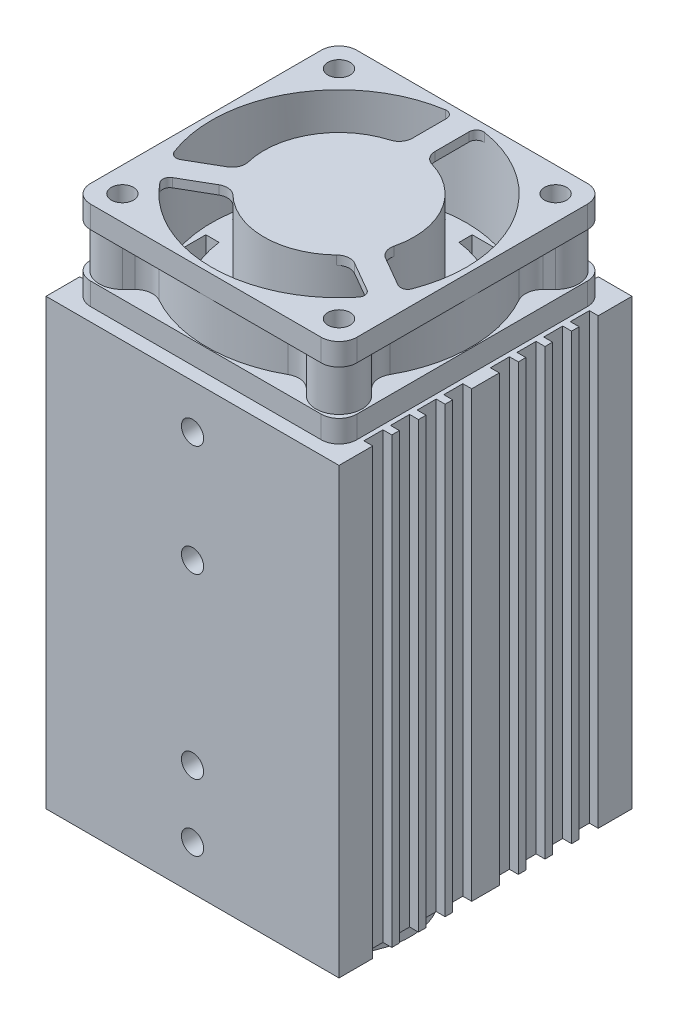
from build123d import *

# Parameters (mm, degrees)
SKIZZE1_W                       = 33
SKIZZE1_H                       = 33
AUFSATZ_LINEAR_AUSTRAGEN1_DEPTH = 50
SKIZZE2_R                       = 1.25
SCHNITT_LINEAR_AUSTRAGEN1_DEPTH = 5
SCHNITT_LINEAR_AUSTRAGEN3_DEPTH = 50
SKIZZE8_W                       = 1
SKIZZE8_H                       = 2.15
SCHNITT_LINEAR_AUSTRAGEN4_DEPTH = 63.982140326
KREISMUSTER10_COUNT             = 3
KREISMUSTER10_ANGLE             = 180
SKIZZE9_W                       = 30
SKIZZE9_H                       = 30
AUFSATZ_LINEAR_AUSTRAGEN4_DEPTH = 10
SCHNITT_LINEAR_AUSTRAGEN5_DEPTH = 10
SKIZZE12_R                      = 14.35
SKIZZE12_R_2                    = 8.45
SCHNITT_LINEAR_AUSTRAGEN6_DEPTH = 9
SKIZZE13_R                      = 1.25
SCHNITT_LINEAR_AUSTRAGEN7_DEPTH = 10
VERRUNDUNG3_R                   = 2
VERRUNDUNG4_R                   = 0.8
VERRUNDUNG5_START               = 59
VERRUNDUNG5_DEPTH               = 1
SCHNITT_LINEAR_AUSTRAGEN8_DEPTH = 5
KREISMUSTER11_COUNT             = 4


with BuildPart() as part:
    # Skizze1 → Aufsatz-Linear austragen1 (new body)
    with BuildSketch(Plane(origin=(0, 0, 0), x_dir=(1, 0, 0), z_dir=(0, 1, 0))):
        Rectangle(SKIZZE1_W, SKIZZE1_H)
    extrude(amount=AUFSATZ_LINEAR_AUSTRAGEN1_DEPTH)

    # Skizze2 → Schnitt-Linear austragen1 (cut)
    with BuildSketch(Plane.XY.offset(16.5)):
        with Locations((0, 5)):
            Circle(SKIZZE2_R)
        with Locations((0, 45)):
            Circle(SKIZZE2_R)
        with Locations((0, 12.5)):
            Circle(SKIZZE2_R)
        with Locations((0, 32.5)):
            Circle(SKIZZE2_R)
    extrude(amount=-SCHNITT_LINEAR_AUSTRAGEN1_DEPTH, mode=Mode.SUBTRACT)

    # Skizze16 → Rotation1 (revolve)
    with BuildSketch(Plane.XY):
        Polygon((-2.45, 0), (-2.45, -8.5), (-8, -8.5), (-8, -3.5), (-4.5, -3.5), (-4.5, 0), align=None)
    revolve(axis=Axis((0, 0, 0), (0, -1, 0)))

    # Skizze7 → Schnitt-Linear austragen3 (cut)
    with BuildSketch(Plane(origin=(0, 50, 0), x_dir=(1, 0, 0), z_dir=(0, 1, 0))):
        with BuildLine():
            Line((-1.5, 12.006664816), (-1.5, 13.5))
            Line((-1.5, 13.5), (-11.02873213, 13.5))
            ThreePointArc((-11.02873213, 13.5), (-10.599467336, 12.910682177), (-10.447591975, 12.197591975))
            Line((-10.447591975, 12.197591975), (-11.197591975, 12.197591975))
            ThreePointArc((-11.197591975, 12.197591975), (-12.904698757, 12.904698757), (-12.197591975, 11.197591975))
            Line((-12.197591975, 11.197591975), (-12.197591975, 10.447591975))
            ThreePointArc((-12.197591975, 10.447591975), (-12.910682177, 10.599467336), (-13.5, 11.02873213))
            Line((-13.5, 11.02873213), (-13.5, 1.5))
            Line((-13.5, 1.5), (-12.006664816, 1.5))
            ThreePointArc((-12.006664816, 1.5), (-8.555992052, 8.555992052), (-1.5, 12.006664816))
        make_face()
        with BuildLine():
            Line((1.5, 13.5), (1.5, 12.006664816))
            ThreePointArc((1.5, 12.006664816), (8.555992052, 8.555992052), (12.006664816, 1.5))
            Line((12.006664816, 1.5), (13.5, 1.5))
            Line((13.5, 1.5), (13.5, 11.02873213))
            ThreePointArc((13.5, 11.02873213), (12.910682177, 10.599467336), (12.197591975, 10.447591975))
            Line((12.197591975, 10.447591975), (12.197591975, 11.197591975))
            ThreePointArc((12.197591975, 11.197591975), (12.904698757, 12.904698757), (11.197591975, 12.197591975))
            Line((11.197591975, 12.197591975), (10.447591975, 12.197591975))
            ThreePointArc((10.447591975, 12.197591975), (10.599467336, 12.910682177), (11.02873213, 13.5))
            Line((11.02873213, 13.5), (1.5, 13.5))
        make_face()
        with BuildLine():
            Line((13.5, -1.5), (12.006664816, -1.5))
            ThreePointArc((12.006664816, -1.5), (8.555992052, -8.555992052), (1.5, -12.006664816))
            Line((1.5, -12.006664816), (1.5, -13.5))
            Line((1.5, -13.5), (11.02873213, -13.5))
            ThreePointArc((11.02873213, -13.5), (10.599467336, -12.910682177), (10.447591975, -12.197591975))
            Line((10.447591975, -12.197591975), (11.197591975, -12.197591975))
            ThreePointArc((11.197591975, -12.197591975), (12.904698757, -12.904698757), (12.197591975, -11.197591975))
            Line((12.197591975, -11.197591975), (12.197591975, -10.447591975))
            ThreePointArc((12.197591975, -10.447591975), (12.910682177, -10.599467336), (13.5, -11.02873213))
            Line((13.5, -11.02873213), (13.5, -1.5))
        make_face()
        with BuildLine():
            Line((-1.5, -13.5), (-1.5, -12.006664816))
            ThreePointArc((-1.5, -12.006664816), (-8.555992052, -8.555992052), (-12.006664816, -1.5))
            Line((-12.006664816, -1.5), (-13.5, -1.5))
            Line((-13.5, -1.5), (-13.5, -11.02873213))
            ThreePointArc((-13.5, -11.02873213), (-12.910682177, -10.599467336), (-12.197591975, -10.447591975))
            Line((-12.197591975, -10.447591975), (-12.197591975, -11.197591975))
            ThreePointArc((-12.197591975, -11.197591975), (-12.904698757, -12.904698757), (-11.197591975, -12.197591975))
            Line((-11.197591975, -12.197591975), (-10.447591975, -12.197591975))
            ThreePointArc((-10.447591975, -12.197591975), (-10.599467336, -12.910682177), (-11.02873213, -13.5))
            Line((-11.02873213, -13.5), (-1.5, -13.5))
        make_face()
    extrude(amount=-SCHNITT_LINEAR_AUSTRAGEN3_DEPTH, mode=Mode.SUBTRACT)

    # Skizze8 → Schnitt-Linear austragen4 (cut, through all)
    with BuildSketch(Plane(origin=(0, 50, 0), x_dir=(1, 0, 0), z_dir=(0, 1, 0))):
        with Locations((-16, 2.625)):
            Rectangle(SKIZZE8_W, SKIZZE8_H)
        with Locations((-16, 5.625)):
            Rectangle(SKIZZE8_W, SKIZZE8_H)
        with Locations((-16, 8.625)):
            Rectangle(SKIZZE8_W, SKIZZE8_H)
        with Locations((-16, 11.625)):
            Rectangle(SKIZZE8_W, SKIZZE8_H)
        with Locations((-16, -2.625)):
            Rectangle(SKIZZE8_W, SKIZZE8_H)
        with Locations((-16, -5.625)):
            Rectangle(SKIZZE8_W, SKIZZE8_H)
        with Locations((-16, -8.625)):
            Rectangle(SKIZZE8_W, SKIZZE8_H)
        with Locations((-16, -11.625)):
            Rectangle(SKIZZE8_W, SKIZZE8_H)
    schnitt_linear_austragen4 = extrude(amount=-SCHNITT_LINEAR_AUSTRAGEN4_DEPTH, mode=Mode.SUBTRACT)

    # Kreismuster10: Schnitt-Linear austragen4 ×3 about axis
    kreismuster10_axis = Axis((0, 0, 0), (0, -1, 0))
    for i in range(1, KREISMUSTER10_COUNT):
        add(schnitt_linear_austragen4.rotate(kreismuster10_axis, i * KREISMUSTER10_ANGLE / (KREISMUSTER10_COUNT - 1)), mode=Mode.SUBTRACT)


with BuildPart() as body_2:
    # Skizze9 → Aufsatz-Linear austragen4 (new body)
    with BuildSketch(Plane(origin=(0, 50, 0), x_dir=(1, 0, 0), z_dir=(0, 1, 0))):
        Rectangle(SKIZZE9_W, SKIZZE9_H)
    extrude(amount=AUFSATZ_LINEAR_AUSTRAGEN4_DEPTH)

    # Skizze11 → Schnitt-Linear austragen5 (cut)
    with BuildSketch(Plane(origin=(0, 60, 0), x_dir=(1, 0, 0), z_dir=(0, 1, 0))):
        with BuildLine():
            Line((-13.017926927, -6.037886926), (-7.873469085, -3.067732806))
            ThreePointArc((-7.873469085, -3.067732806), (-7.317914662, 4.225), (-1.28, 8.352490647))
            Line((-1.28, 8.352490647), (-1.28, 14.292798886))
            ThreePointArc((-1.28, 14.292798886), (-12.427464544, 7.175), (-13.017926927, -6.037886926))
        make_face()
        with BuildLine():
            Line((-11.737926927, -8.25491196), (-6.593469085, -5.28475784))
            ThreePointArc((-6.593469085, -5.28475784), (0, -8.45), (6.593469085, -5.28475784))
            Line((6.593469085, -5.28475784), (11.737926927, -8.25491196))
            ThreePointArc((11.737926927, -8.25491196), (0, -14.35), (-11.737926927, -8.25491196))
        make_face()
        with BuildLine():
            Line((7.873469085, -3.067732806), (13.017926927, -6.037886926))
            ThreePointArc((13.017926927, -6.037886926), (12.427464544, 7.175), (1.28, 14.292798886))
            Line((1.28, 14.292798886), (1.28, 8.352490647))
            ThreePointArc((1.28, 8.352490647), (7.317914662, 4.225), (7.873469085, -3.067732806))
        make_face()
    extrude(amount=-SCHNITT_LINEAR_AUSTRAGEN5_DEPTH, mode=Mode.SUBTRACT)

    # Skizze12 → Schnitt-Linear austragen6 (cut)
    with BuildSketch(Plane.XZ.offset(-50)):
        with Locations(Location((0, 0, 0), (0, 0, 90))):
            Circle(SKIZZE12_R)
        with Locations(Location((0, 0, 0), (0, 0, 90))):
            Circle(SKIZZE12_R_2, mode=Mode.SUBTRACT)
    extrude(amount=-SCHNITT_LINEAR_AUSTRAGEN6_DEPTH, mode=Mode.SUBTRACT)

    # Skizze13 → Schnitt-Linear austragen7 (cut)
    with BuildSketch(Plane(origin=(0, 60, 0), x_dir=(1, 0, 0), z_dir=(0, 1, 0))):
        with Locations(Location((-12.197591975, -12.197591975, 0), (0, 0, 270))):
            Circle(SKIZZE13_R)
        with Locations(Location((12.197591975, -12.197591975, 0), (0, 0, 270))):
            Circle(SKIZZE13_R)
        with Locations(Location((-12.197591975, 12.197591975, 0), (0, 0, 270))):
            Circle(SKIZZE13_R)
        with Locations(Location((12.197591975, 12.197591975, 0), (0, 0, 270))):
            Circle(SKIZZE13_R)
    extrude(amount=-SCHNITT_LINEAR_AUSTRAGEN7_DEPTH, mode=Mode.SUBTRACT)

    # Verrundung3
    verrundung3_edges = [body_2.edges().sort_by_distance(p)[0] for p in [
        (-15, 55, -15),
        (15, 55, -15),
        (15, 55, 15),
        (-15, 55, 15),
    ]]
    fillet(verrundung3_edges, radius=VERRUNDUNG3_R)

    # Verrundung4
    # the kernel refuses this fillet: 0.8 mm, written as the material it adds along each edge
    with BuildSketch(Plane(origin=(13.017926927, 60, 6.037886926), x_dir=(-0.8660254037844402, 0, -0.49999999999999756), z_dir=(0, -1, 0)), Plane(origin=(-11.737926927, 60, 8.25491196), x_dir=(0.8660254037844402, 0, -0.4999999999999972), z_dir=(0, -1, 0)), Plane(origin=(-1.28, 60, -14.292798886), x_dir=(0, 0, 1), z_dir=(0, -1, 0))) as verrundung4_piece_1:
        with BuildLine():
            CenterArc((0.90339636, 0.8), VERRUNDUNG4_R, 171.169867532, 98.830132468)
            ThreePointArc((0.11287813, 0.922804428), (0.048963976, 0.462316573), (0, 0))
            Line((0, 0), (0.90339636, 0))
        make_face()
    extrude(amount=1)
    with BuildSketch(Plane(origin=(1.28, 60, -14.292798886), x_dir=(0.9926017359315809, 0, 0.12141578902931878), z_dir=(0, -1, 0)), Plane(origin=(11.737926927, 60, 8.25491196), x_dir=(-0.6014500256857082, 0, 0.7989104246426261), z_dir=(0, -1, 0))) as verrundung4_piece_2:
        with BuildLine():
            CenterArc((0.903767971, 0.799580164), VERRUNDUNG4_R, 173.026181175, 98.830132467)
            Line((0.109686582, 0.896712795), (0, 0))
            ThreePointArc((0, 0), (0.464841232, -0.007530804), (0.929682464, 0))
        make_face()
    extrude(amount=1)
    with BuildSketch(Plane(origin=(-13.017926927, 60, 6.037886926), x_dir=(0.8660254037844399, 0, -0.4999999999999977), z_dir=(0, -1, 0))) as verrundung4_piece_3:
        with BuildLine():
            CenterArc((0.90339636, -0.8), VERRUNDUNG4_R, 90, 98.830132468)
            ThreePointArc((0.11287813, -0.922804428), (0.048963976, -0.462316573), (0, 0))
            Line((0, 0), (0.90339636, 0))
        make_face()
    extrude(amount=1)

    # Verrundung5: read off the stored shape, not the designer's step
    # Verrundung5 outline → Verrundung5 (add)
    with BuildSketch(Plane(origin=(0, 0, 0), x_dir=(1, 0, 0), z_dir=(0, 1, 0)).offset(VERRUNDUNG5_START)):
        with BuildLine():
            ThreePointArc((8.913788431, -3.668361461), (8.284180593, -2.958120615), (8.206935904, -2.01213893))
            ThreePointArc((8.206935904, -2.01213893), (8.057507416, -2.54540257), (7.873469085, -3.067732806))
            Line((7.873469085, -3.067732806), (8.913788431, -3.668361461))
        make_face()
        with BuildLine():
            Line((7.633788431, -5.885386495), (6.593469085, -5.28475784))
            ThreePointArc((6.593469085, -5.28475784), (6.233136997, -5.705304828), (5.846031381, -6.101345515))
            ThreePointArc((5.846031381, -6.101345515), (6.703897896, -5.695250535), (7.633788431, -5.885386495))
        make_face()
        with BuildLine():
            ThreePointArc((1.28, 8.352490647), (1.824370419, 8.250707398), (2.360904523, 8.113484445))
            ThreePointArc((2.360904523, 8.113484445), (1.580282697, 8.65337115), (1.28, 9.553747956))
            Line((1.28, 9.553747956), (1.28, 8.352490647))
        make_face()
        with BuildLine():
            ThreePointArc((-7.633788431, -5.885386495), (-6.703897896, -5.695250535), (-5.846031381, -6.101345515))
            ThreePointArc((-5.846031381, -6.101345515), (-6.233136997, -5.705304828), (-6.593469085, -5.28475784))
            Line((-6.593469085, -5.28475784), (-7.633788431, -5.885386495))
        make_face()
        with BuildLine():
            ThreePointArc((-2.360904523, 8.113484445), (-1.824370419, 8.250707398), (-1.28, 8.352490647))
            Line((-1.28, 8.352490647), (-1.28, 9.553747956))
            ThreePointArc((-1.28, 9.553747956), (-1.580282697, 8.65337115), (-2.360904523, 8.113484445))
        make_face()
        with BuildLine():
            Line((-8.913788431, -3.668361461), (-7.873469085, -3.067732806))
            ThreePointArc((-7.873469085, -3.067732806), (-8.057507416, -2.54540257), (-8.206935904, -2.01213893))
            ThreePointArc((-8.206935904, -2.01213893), (-8.284180593, -2.958120615), (-8.913788431, -3.668361461))
        make_face()
    extrude(amount=VERRUNDUNG5_DEPTH)

    # Skizze14 → Schnitt-Linear austragen8 (cut)
    with BuildSketch(Plane(origin=(0, 57.5, 0), x_dir=(1, 0, 0), z_dir=(0, 1, 0))):
        with BuildLine():
            Line((-13.337390623, 9.660435361), (-14.036069607, 10.359114344))
            ThreePointArc((-14.036069607, 10.359114344), (-14.797591975, 12.197591975), (-14.036069607, 14.036069607))
            Line((-14.036069607, 14.036069607), (-14.414213562, 14.414213562))
            ThreePointArc((-14.414213562, 14.414213562), (-14.847759065, 13.765366865), (-15, 13))
            Line((-15, 13), (-15, -13))
            ThreePointArc((-15, -13), (-14.847759065, -13.765366865), (-14.414213562, -14.414213562))
            Line((-14.414213562, -14.414213562), (-14.036069607, -14.036069607))
            ThreePointArc((-14.036069607, -14.036069607), (-14.797591975, -12.197591975), (-14.036069607, -10.359114344))
            Line((-14.036069607, -10.359114344), (-13.337390623, -9.660435361))
            ThreePointArc((-13.337390623, -9.660435361), (-12.770572277, -8.521017321), (-13.005852211, -7.270337562))
            ThreePointArc((-13.005852211, -7.270337562), (-14.9, 0), (-13.005852211, 7.270337562))
            ThreePointArc((-13.005852211, 7.270337562), (-12.770572277, 8.521017321), (-13.337390623, 9.660435361))
        make_face()
    schnitt_linear_austragen8 = extrude(amount=-SCHNITT_LINEAR_AUSTRAGEN8_DEPTH, mode=Mode.SUBTRACT)

    # Kreismuster11: Schnitt-Linear austragen8 ×4 about axis
    kreismuster11_axis = Axis((0, 0, 0), (0, 1, 0))
    for i in range(1, KREISMUSTER11_COUNT):
        add(schnitt_linear_austragen8.rotate(kreismuster11_axis, i * 360 / KREISMUSTER11_COUNT), mode=Mode.SUBTRACT)


solid = Compound([part.part, body_2.part])
